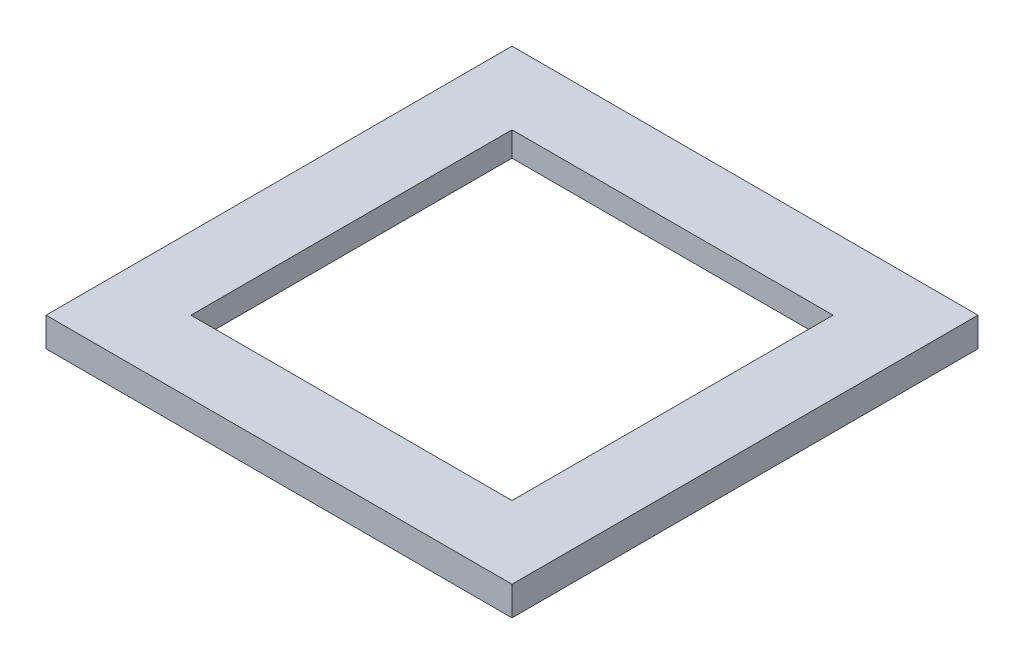
from build123d import *

# Parameters (mm, degrees)
SKETCH1_W           = 50.8
SKETCH1_H           = 50.8
SKETCH1_W_2         = 35
SKETCH1_H_2         = 35
BOSS_EXTRUDE1_DEPTH = 3.175
CUT_EXTRUDE1_DEPTH  = 0.5


with BuildPart() as part:
    # Sketch1 → Boss-Extrude1 (new body)
    with BuildSketch(Plane(origin=(0, 0, 0), x_dir=(1, 0, 0), z_dir=(0, 1, 0))):
        with Locations((25.4, 25.4)):
            Rectangle(SKETCH1_W, SKETCH1_H)
        with Locations((25.4, 25.4)):
            Rectangle(SKETCH1_W_2, SKETCH1_H_2, mode=Mode.SUBTRACT)
    extrude(amount=BOSS_EXTRUDE1_DEPTH)

    # Sketch2 → Cut-Extrude1 (cut)
    with BuildSketch(Plane.XZ):
        with BuildLine():
            Line((46.0375, -1.5875), (4.7625, -1.5875))
            ThreePointArc((4.7625, -1.5875), (2.51743597, -2.51743597), (1.5875, -4.7625))
            Line((1.5875, -4.7625), (1.5875, -46.0375))
            ThreePointArc((1.5875, -46.0375), (2.51743597, -48.28256403), (4.7625, -49.2125))
            Line((4.7625, -49.2125), (46.0375, -49.2125))
            ThreePointArc((46.0375, -49.2125), (48.28256403, -48.28256403), (49.2125, -46.0375))
            Line((49.2125, -46.0375), (49.2125, -4.7625))
            ThreePointArc((49.2125, -4.7625), (48.28256403, -2.51743597), (46.0375, -1.5875))
        make_face()
    extrude(amount=-CUT_EXTRUDE1_DEPTH, mode=Mode.SUBTRACT)


solid = part.part
